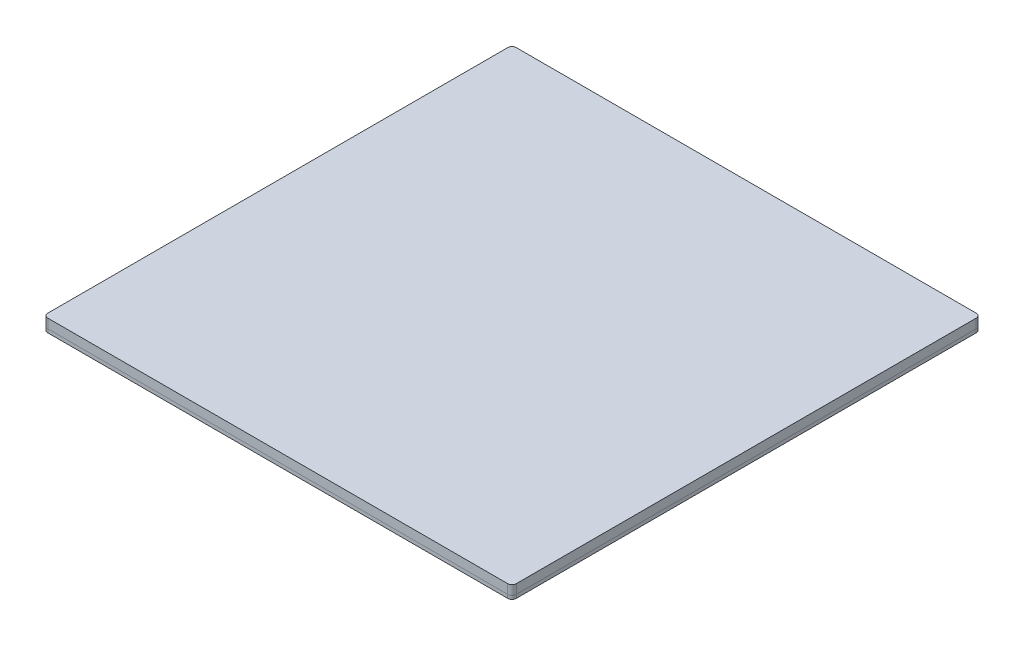
from build123d import *

# Parameters (mm, degrees)
SKETCH1_W           = 220
SKETCH1_H           = 220
BOSS_EXTRUDE1_DEPTH = 4.35
SKETCH2_W           = 220
SKETCH2_H           = 220
BOSS_EXTRUDE2_DEPTH = 1.65
SKETCH4_R           = 1.5
CUT_EXTRUDE1_DEPTH  = 156.624299195
FILLET1_R           = 2
FILLET2_R           = 2


with BuildPart() as part:
    # Sketch1 → Boss-Extrude1 (new body)
    with BuildSketch(Plane(origin=(0, 0, 0), x_dir=(1, 0, 0), z_dir=(0, 1, 0))):
        Rectangle(SKETCH1_W, SKETCH1_H)
    extrude(amount=BOSS_EXTRUDE1_DEPTH)

    # Fillet1
    fillet1_edges = [part.edges().sort_by_distance(p)[0] for p in [
        (110, 2.175, 110),
        (110, 2.175, -110),
        (-110, 2.175, -110),
        (-110, 2.175, 110),
    ]]
    fillet(fillet1_edges, radius=FILLET1_R)


with BuildPart() as body_2:
    # Sketch2 → Boss-Extrude2 (new body)
    with BuildSketch(Plane.XZ):
        Rectangle(SKETCH2_W, SKETCH2_H)
    extrude(amount=BOSS_EXTRUDE2_DEPTH)

    # Sketch4 → Cut-Extrude1 (cut, through all)
    with BuildSketch(Plane(origin=(0, 0, 0), x_dir=(1, 0, 0), z_dir=(0, 1, 0))):
        with Locations((-104.5, 104.5)):
            Circle(SKETCH4_R)
        with Locations((104.5, 104.5)):
            Circle(SKETCH4_R)
        with Locations((104.5, -104.5)):
            Circle(SKETCH4_R)
        with Locations((-104.5, -104.5)):
            Circle(SKETCH4_R)
    extrude(amount=-CUT_EXTRUDE1_DEPTH, mode=Mode.SUBTRACT)

    # Fillet2
    fillet2_edges = [body_2.edges().sort_by_distance(p)[0] for p in [
        (-110, -0.825, -110),
        (-110, -0.825, 110),
        (110, -0.825, -110),
        (110, -0.825, 110),
    ]]
    fillet(fillet2_edges, radius=FILLET2_R)


solid = Compound([part.part, body_2.part])
